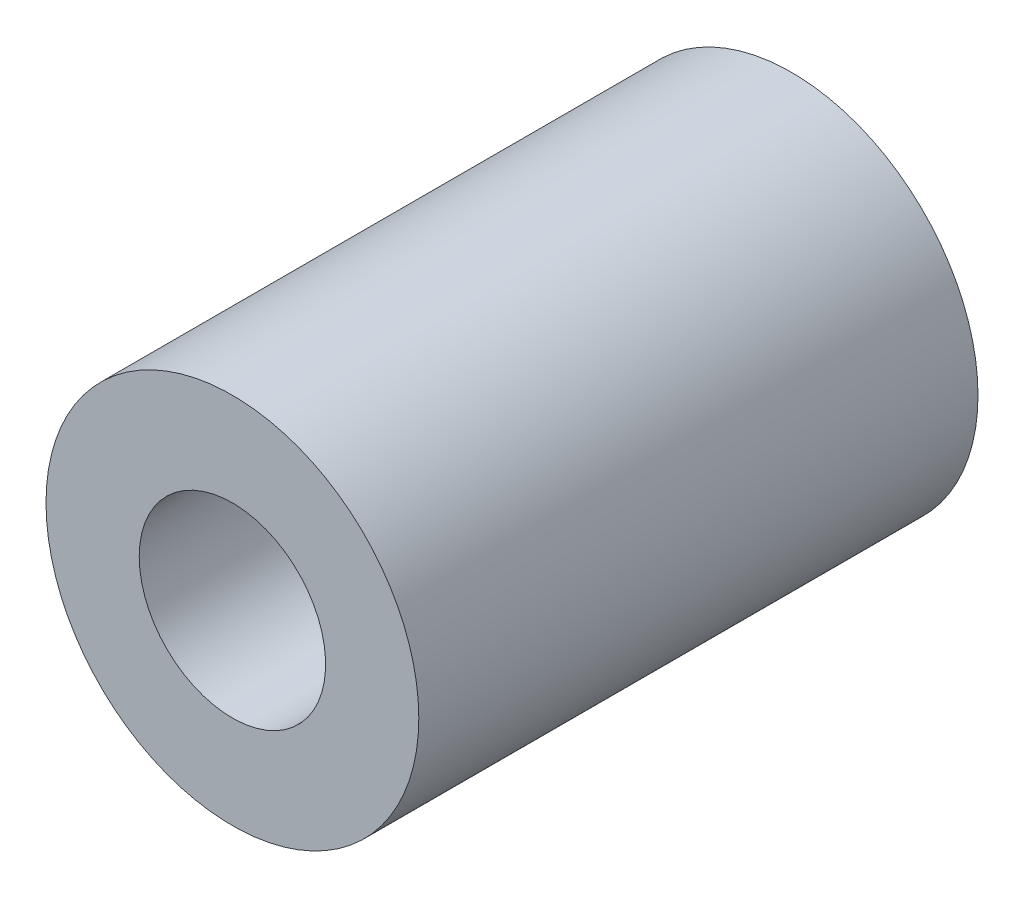
from build123d import *

# Parameters (mm, degrees)
ESQUISSE1_R           = 5
EXTRUSION1_DEPTH      = 15
TROU_TARAUD_M6X1_01_D = 5


with BuildPart() as part:
    # Esquisse1 → Extrusion1 (new body)
    with BuildSketch(Plane.XY):
        Circle(ESQUISSE1_R)
    extrude(amount=EXTRUSION1_DEPTH)

    # Trou taraudé M6x1.01 (through all)
    with Locations(Plane(origin=(0, 0, 0), x_dir=(-1, 0, 0), z_dir=(0, 0, -1))):
        with Locations((0, 0)):
            Hole(TROU_TARAUD_M6X1_01_D / 2)


solid = part.part
